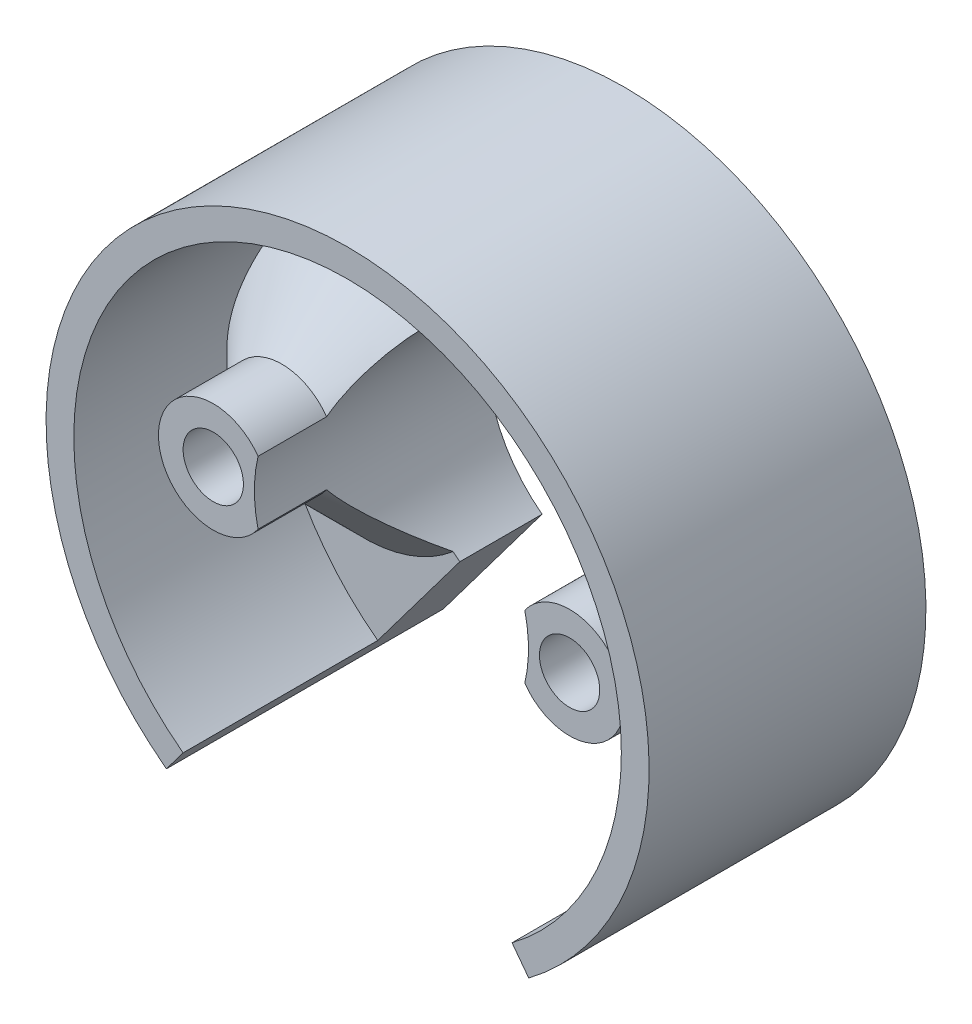
from build123d import *
from build123d.topology import SkipClean

# Parameters (mm, degrees)
SKETCH_1_R          = 11
SKETCH_1_R_2        = 5
SKETCH_1_R_3        = 1.1
EXTRUDE_1_DEPTH     = 3
EXTRUDE_2_DEPTH     = 5.5
EXTRUDE_3_DEPTH     = 7.1
CHAMFER_1_SIZE      = 3
CUT_EXTRUDE_1_DEPTH = 10
CUT_EXTRUDE_2_REACH = 19.1
SKETCH_5_R          = 1.1


with BuildPart() as part:
    # 草图1 → 凸台-拉伸1 (new body)
    with BuildSketch(Plane.XY):
        Circle(SKETCH_1_R)
        Circle(SKETCH_1_R_2, mode=Mode.SUBTRACT)
        with Locations((-6.5, 0)):
            Circle(SKETCH_1_R_3, mode=Mode.SUBTRACT)
        with Locations((6.5, 0)):
            Circle(SKETCH_1_R_3, mode=Mode.SUBTRACT)
    extrude(amount=EXTRUDE_1_DEPTH)

    # 草图2 → 凸台-拉伸2 (add)
    with SkipClean():  # the faces are left unmerged after this step: merging them gives an invalid solid
        with BuildSketch(Plane.XY.offset(3)):
            with BuildLine():
                ThreePointArc((4.865384615, -1.152402944), (8.5, 0), (4.865384615, 1.152402944))
                ThreePointArc((4.865384615, 1.152402944), (5, 0), (4.865384615, -1.152402944))
            make_face()
            with BuildLine():
                ThreePointArc((-4.865384615, 1.152402944), (-8.5, 0), (-4.865384615, -1.152402944))
                ThreePointArc((-4.865384615, -1.152402944), (-5, 0), (-4.865384615, 1.152402944))
            make_face()
        extrude(amount=EXTRUDE_2_DEPTH)

    # 草图3 → 凸台-拉伸3 (add)
    with SkipClean():  # the faces are left unmerged after this step: merging them gives an invalid solid
        with BuildSketch(Plane.XY.offset(3)):
            with BuildLine():
                Line((-6.60837923, -8.79370934), (-6, -7.984144705))
                ThreePointArc((-6, -7.984144705), (0, 9.987320295), (6, -7.984144705))
                Line((6, -7.984144705), (6.60837923, -8.79370934))
                ThreePointArc((6.60837923, -8.79370934), (0, 11), (-6.60837923, -8.79370934))
            make_face()
        extrude(amount=EXTRUDE_3_DEPTH)

    # 倒角1
    # the kernel refuses this chamfer: 3 mm, written as the material it adds along each edge
    with BuildSketch(Plane(origin=(6.5, 0, 3), x_dir=(-0.9999950652018583, -0.0031415874858795587, 0), z_dir=(-0.0031415874858795587, 0.9999950652018583, 0))) as chamfer_1_piece_1_section:
        Polygon((2 + CHAMFER_1_SIZE, 0), (2, CHAMFER_1_SIZE), (2, 0), align=None)
    chamfer_1_piece_1 = revolve(axis=Axis((6.5, 0, 3), (0, 0, 1)), revolution_arc=359.64, mode=Mode.PRIVATE)
    chamfer_1_piece_1 = chamfer_1_piece_1 - Plane(origin=(0, 0, 3.47273438), x_dir=(1, 0, 0), z_dir=(0, 0, -1)) * Cylinder(5, 21, mode=Mode.PRIVATE)
    chamfer_1_piece_1 = chamfer_1_piece_1 & Plane(origin=(0, 0, 3.47273438), x_dir=(-0.6007617481958082, -0.7994281217875167, 0), z_dir=(0, 0, -1)) * Cylinder(9.987320295, 21, mode=Mode.PRIVATE)
    add(chamfer_1_piece_1)
    with BuildSketch(Plane(origin=(-6.5, 0, 3), x_dir=(0.9999950652018583, 0.0031415874858795045, 0), z_dir=(0.0031415874858795045, -0.9999950652018583, 0))) as chamfer_1_piece_2_section:
        Polygon((2 + CHAMFER_1_SIZE, 0), (2, CHAMFER_1_SIZE), (2, 0), align=None)
    chamfer_1_piece_2 = revolve(axis=Axis((-6.5, 0, 3), (0, 0, 1)), revolution_arc=359.64, mode=Mode.PRIVATE)
    chamfer_1_piece_2 = chamfer_1_piece_2 - Plane(origin=(0, 0, 3.472734386), x_dir=(1, 0, 0), z_dir=(0, 0, -1)) * Cylinder(5, 21, mode=Mode.PRIVATE)
    chamfer_1_piece_2 = chamfer_1_piece_2 & Plane(origin=(0, 0, 3.472734386), x_dir=(-0.6007617481958082, -0.7994281217875167, 0), z_dir=(0, 0, -1)) * Cylinder(9.987320295, 21, mode=Mode.PRIVATE)
    add(chamfer_1_piece_2)

    # 草图4 → 切除-拉伸1 (cut)
    with BuildSketch(Plane(origin=(0, 0, 0), x_dir=(-1, 0, 0), z_dir=(0, 0, -1))):
        with BuildLine():
            ThreePointArc((-6.60837923, -8.79370934), (0, -11), (6.60837923, -8.79370934))
            Line((6.60837923, -8.79370934), (3.003808741, -3.997140609))
            ThreePointArc((3.003808741, -3.997140609), (0, -5), (-3.003808741, -3.997140609))
            Line((-3.003808741, -3.997140609), (-6.60837923, -8.79370934))
        make_face()
    extrude(amount=-CUT_EXTRUDE_1_DEPTH, mode=Mode.SUBTRACT)

    # 草图5 → 切除-拉伸2 (cut, up to next)
    with BuildSketch(Plane(origin=(0, 0, 3), x_dir=(-1, 0, 0), z_dir=(0, 0, -1)), mode=Mode.PRIVATE) as cut_extrude_2_sk1:
        with Locations(Location((6.5, 0, 0), (0, 0, 180))):
            Circle(SKETCH_5_R)
    cut_extrude_2_tool1 = extrude(cut_extrude_2_sk1.sketch, amount=-CUT_EXTRUDE_2_REACH, mode=Mode.PRIVATE) & part.part
    # 草图5 → 切除-拉伸2 (cut, up to next)
    with BuildSketch(Plane(origin=(0, 0, 3), x_dir=(-1, 0, 0), z_dir=(0, 0, -1)), mode=Mode.PRIVATE) as cut_extrude_2_sk2:
        with Locations(Location((-6.5, 0, 0), (0, 0, 180))):
            Circle(SKETCH_5_R)
    cut_extrude_2_tool2 = extrude(cut_extrude_2_sk2.sketch, amount=-CUT_EXTRUDE_2_REACH, mode=Mode.PRIVATE) & part.part
    add(cut_extrude_2_tool1.solids().sort_by_distance((-6.5, 0, 3))[0], mode=Mode.SUBTRACT)
    add(cut_extrude_2_tool2.solids().sort_by_distance((6.5, 0, 3))[0], mode=Mode.SUBTRACT)


solid = part.part
